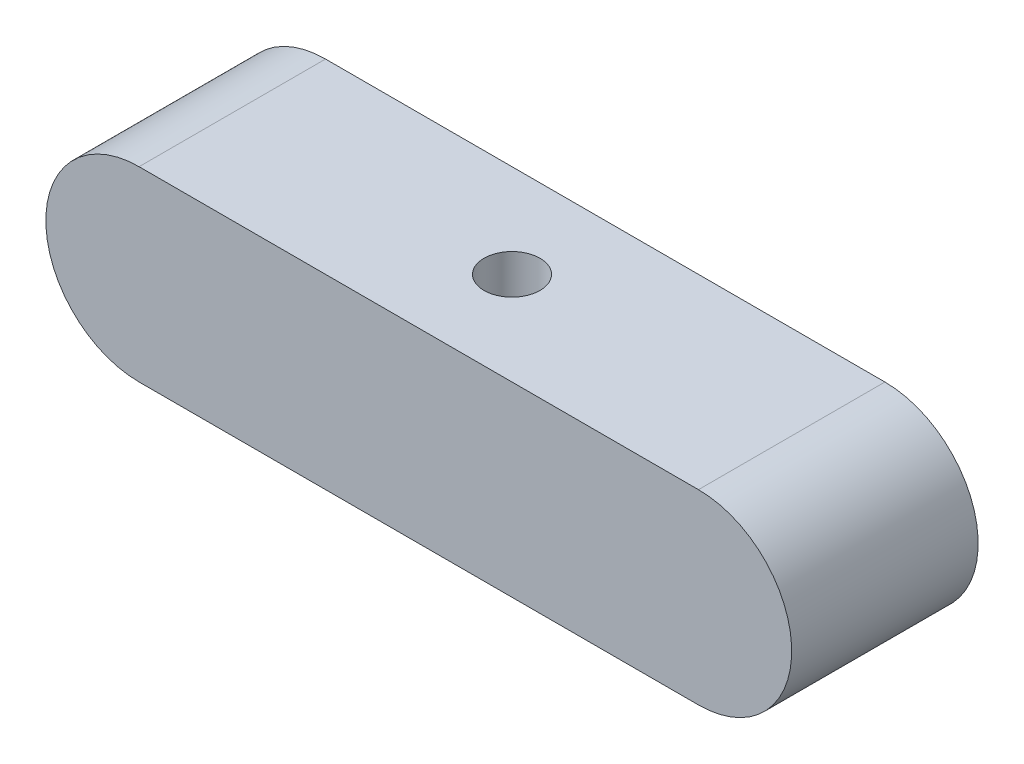
from build123d import *

# Parameters (mm, degrees)
BOSS_EXTRUDE1_DEPTH = 10
SKETCH2_R           = 1.5
CUT_EXTRUDE1_DEPTH  = 38.749172176


with BuildPart() as part:
    # Sketch1 → Boss-Extrude1 (new body)
    with BuildSketch(Plane.XY):
        with BuildLine():
            Line((0, 5), (30, 5))
            ThreePointArc((30, 5), (35, 0), (30, -5))
            Line((30, -5), (0, -5))
            ThreePointArc((0, -5), (-5, 0), (0, 5))
        make_face()
    extrude(amount=BOSS_EXTRUDE1_DEPTH)

    # Sketch2 → Cut-Extrude1 (cut, through all)
    with BuildSketch(Plane(origin=(0, 5, 0), x_dir=(1, 0, 0), z_dir=(0, 1, 0))):
        with Locations((15, -5)):
            Circle(SKETCH2_R)
    extrude(amount=-CUT_EXTRUDE1_DEPTH, mode=Mode.SUBTRACT)


solid = part.part
